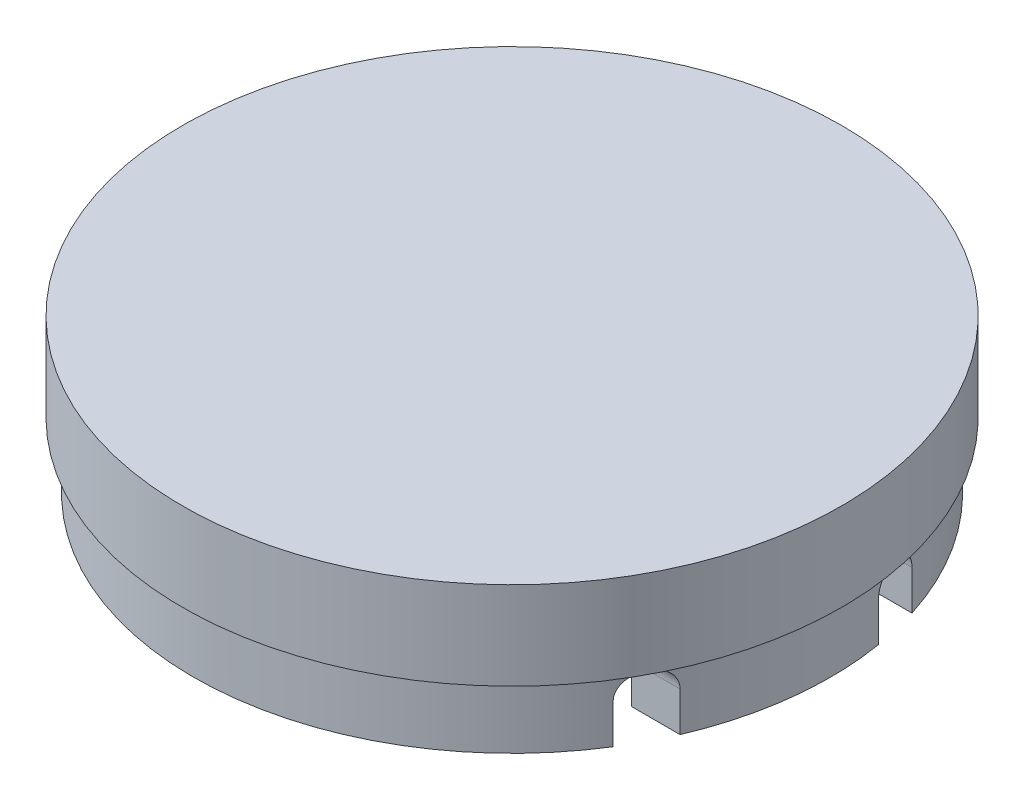
from build123d import *

# Parameters (mm, degrees)
SHELL1_OUTLINE_R        = 79.375
SHELL1_DEPTH            = 31.75
CUT_EXTRUDE2_REACH      = 143.848
CUT_EXTRUDE2_END_RADIUS = 92.075


# Read off the part's stored shape, not the designer's step: Shell1
with BuildPart() as part:
    # Sketch1 → Revolve1 (revolve)
    with BuildSketch(Plane.XY, mode=Mode.PRIVATE) as revolve1_sk:
        Polygon((0, 0), (92.075, 0), (92.075, 19.05), (95.25, 19.05), (95.25, 44.45), (0, 44.45), align=None)
    revolve(revolve1_sk.sketch.rotate(Axis((0, 0, 0), (0, 1, 0)), 90), axis=Axis((0, 0, 0), (0, 1, 0)))

    # Shell1 outline → Shell1 (cut)
    with BuildSketch(Plane(origin=(0, 0, 0), x_dir=(1, 0, 0), z_dir=(0, 1, 0))):
        Circle(SHELL1_OUTLINE_R)
    extrude(amount=SHELL1_DEPTH, mode=Mode.SUBTRACT)

    # Cut-Extrude2: up to this cylinder (the profile starts inside it)
    cut_extrude2_end = Plane(origin=(0, 0, 0), z_dir=(0, -1, 0)) * Cylinder(CUT_EXTRUDE2_END_RADIUS, 472.846, mode=Mode.PRIVATE)
    # Sketch2 → Cut-Extrude2 (cut, up to the surface)
    with BuildSketch(Plane(origin=(0, 0, 0), x_dir=(0, 0, -1), z_dir=(1, 0, 0)), mode=Mode.PRIVATE) as cut_extrude2_sk1:
        with BuildLine():
            Line((-48.830201285, -11.43), (-48.830201285, 11.43))
            ThreePointArc((-48.830201285, 11.43), (-42.480201285, 17.78), (-36.130201285, 11.43))
            Line((-36.130201285, 11.43), (-36.130201285, -11.43))
            ThreePointArc((-36.130201285, -11.43), (-42.480201285, -17.78), (-48.830201285, -11.43))
        make_face()
    cut_extrude2_tool1 = extrude(cut_extrude2_sk1.sketch, amount=CUT_EXTRUDE2_REACH, mode=Mode.PRIVATE) & cut_extrude2_end
    add(cut_extrude2_tool1.solids().sort_by_distance((0, 0, 42.480201))[0], mode=Mode.SUBTRACT)
    # Sketch2 → Cut-Extrude2 (cut, up to the surface)
    with BuildSketch(Plane(origin=(0, 0, 0), x_dir=(0, 0, -1), z_dir=(1, 0, 0)), mode=Mode.PRIVATE) as cut_extrude2_sk2:
        with BuildLine():
            Line((15.101598715, -11.43), (15.101598715, 11.43))
            ThreePointArc((15.101598715, 11.43), (21.451598715, 17.78), (27.801598715, 11.43))
            Line((27.801598715, 11.43), (27.801598715, -11.43))
            ThreePointArc((27.801598715, -11.43), (21.451598715, -17.78), (15.101598715, -11.43))
        make_face()
    cut_extrude2_tool2 = extrude(cut_extrude2_sk2.sketch, amount=CUT_EXTRUDE2_REACH, mode=Mode.PRIVATE) & cut_extrude2_end
    add(cut_extrude2_tool2.solids().sort_by_distance((0, 0, -21.451599))[0], mode=Mode.SUBTRACT)


solid = part.part
